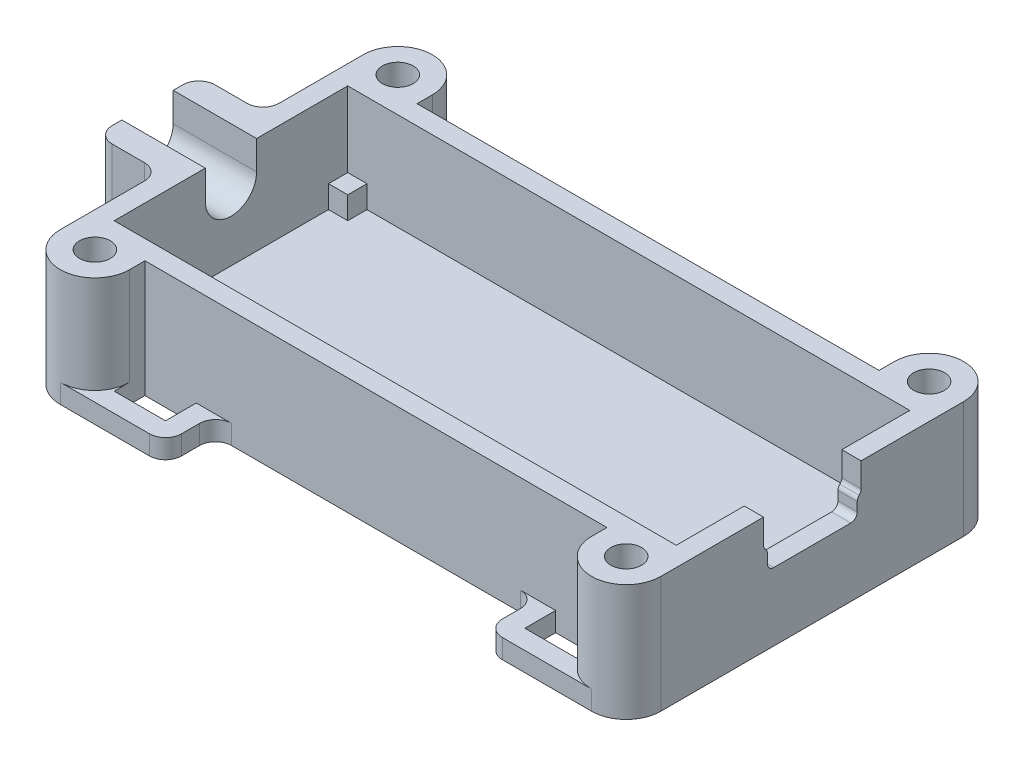
from build123d import *

# Parameters (mm, degrees)
SKETCH1_W           = 43.8
SKETCH1_H           = 18.2
SKETCH1_R           = 1.2
BOSS_EXTRUDE1_DEPTH = 7.6
BOSS_EXTRUDE2_START = 1.5
SKETCH3_R           = 1.2
BOSS_EXTRUDE2_DEPTH = 1.5
CUT_EXTRUDE1_REACH  = 56.325
SKETCH5_W           = 1.5
SKETCH5_H           = 1.5
BOSS_EXTRUDE3_DEPTH = 1.75
CUT_EXTRUDE2_REACH  = 56.325
BOSS_EXTRUDE4_DEPTH = 1.5
FILLET1_R           = 1.25
FILLET2_R           = 0.5


with BuildPart() as part:
    # Sketch1 → Boss-Extrude1 (new body)
    with BuildSketch(Plane(origin=(0, 0, 0), x_dir=(1, 0, 0), z_dir=(0, 1, 0))):
        with BuildLine():
            Line((-23.4, -4), (-23.4, -11.8))
            ThreePointArc((-23.4, -11.8), (-20.7, -14.5), (-18, -11.8))
            Line((-18, -11.8), (-18, -10.6))
            Line((-18, -10.6), (18, -10.6))
            Line((18, -10.6), (18, -11.8))
            ThreePointArc((18, -11.8), (20.7, -14.5), (23.4, -11.8))
            Line((23.4, -11.8), (23.4, 11.8))
            ThreePointArc((23.4, 11.8), (20.7, 14.5), (18, 11.8))
            Line((18, 11.8), (18, 10.6))
            Line((18, 10.6), (-18, 10.6))
            Line((-18, 10.6), (-18, 11.8))
            ThreePointArc((-18, 11.8), (-20.7, 14.5), (-23.4, 11.8))
            Line((-23.4, 11.8), (-23.4, 4))
            Line((-23.4, 4), (-28.4, 4))
            Line((-28.4, 4), (-28.4, -4))
            Line((-28.4, -4), (-23.4, -4))
        make_face()
        Rectangle(SKETCH1_W, SKETCH1_H, mode=Mode.SUBTRACT)
        with Locations((-20.7, -11.8)):
            Circle(SKETCH1_R, mode=Mode.SUBTRACT)
        with Locations((-20.7, 11.8)):
            Circle(SKETCH1_R, mode=Mode.SUBTRACT)
        with Locations((20.7, -11.8)):
            Circle(SKETCH1_R, mode=Mode.SUBTRACT)
        with Locations((20.7, 11.8)):
            Circle(SKETCH1_R, mode=Mode.SUBTRACT)
    extrude(amount=BOSS_EXTRUDE1_DEPTH)

    # Sketch3 → Boss-Extrude2 (add)
    with BuildSketch(Plane.XZ.offset(BOSS_EXTRUDE2_START)):
        with BuildLine():
            Line((-23.4, -4), (-23.4, -11.8))
            ThreePointArc((-23.4, -11.8), (-20.7, -14.5), (-18, -11.8))
            Line((-18, -11.8), (-18, -10.6))
            Line((-18, -10.6), (18, -10.6))
            Line((18, -10.6), (18, -11.8))
            ThreePointArc((18, -11.8), (20.7, -14.5), (23.4, -11.8))
            Line((23.4, -11.8), (23.4, 11.8))
            ThreePointArc((23.4, 11.8), (20.7, 14.5), (18, 11.8))
            Line((18, 11.8), (18, 10.6))
            Line((18, 10.6), (-18, 10.6))
            Line((-18, 10.6), (-18, 11.8))
            ThreePointArc((-18, 11.8), (-20.7, 14.5), (-23.4, 11.8))
            Line((-23.4, 11.8), (-23.4, 4))
            Line((-23.4, 4), (-28.4, 4))
            Line((-28.4, 4), (-28.4, -4))
            Line((-28.4, -4), (-23.4, -4))
        make_face()
        with Locations((-20.7, -11.8)):
            Circle(SKETCH3_R, mode=Mode.SUBTRACT)
        with Locations((20.7, -11.8)):
            Circle(SKETCH3_R, mode=Mode.SUBTRACT)
        with Locations((20.7, 11.8)):
            Circle(SKETCH3_R, mode=Mode.SUBTRACT)
        with Locations((-20.7, 11.8)):
            Circle(SKETCH3_R, mode=Mode.SUBTRACT)
    extrude(amount=-BOSS_EXTRUDE2_DEPTH)

    # Sketch4 → Cut-Extrude1 (cut, up to next)
    with BuildSketch(Plane.ZY.offset(28.4), mode=Mode.PRIVATE) as cut_extrude1_sk1:
        with BuildLine():
            Line((-2, 7.6), (-2, 5.35))
            ThreePointArc((-2, 5.35), (0, 3.35), (2, 5.35))
            Line((2, 5.35), (2, 7.6))
            Line((2, 7.6), (-2, 7.6))
        make_face()
    cut_extrude1_tool1 = extrude(cut_extrude1_sk1.sketch, amount=-CUT_EXTRUDE1_REACH, mode=Mode.PRIVATE) & part.part
    add(cut_extrude1_tool1.solids().sort_by_distance((-28.4, 5.663525, 0))[0], mode=Mode.SUBTRACT)

    # Sketch5 → Boss-Extrude3 (add)
    with BuildSketch(Plane(origin=(0, 0, 0), x_dir=(1, 0, 0), z_dir=(0, 1, 0))):
        with Locations((-21.15, 8.35)):
            Rectangle(SKETCH5_W, SKETCH5_H)
        with Locations((21.15, 8.35)):
            Rectangle(SKETCH5_W, SKETCH5_H)
        with Locations((-21.15, -8.35)):
            Rectangle(SKETCH5_W, SKETCH5_H)
        with Locations((21.15, -8.35)):
            Rectangle(SKETCH5_W, SKETCH5_H)
    extrude(amount=BOSS_EXTRUDE3_DEPTH)

    # Sketch6 → Cut-Extrude2 (cut, up to next)
    with BuildSketch(Plane(origin=(23.4, 0, 0), x_dir=(0, 0, -1), z_dir=(1, 0, 0)), mode=Mode.PRIVATE) as cut_extrude2_sk1:
        Polygon((3.8, 7.6), (-3.8, 7.6), (-3.8, 5.5), (-3.5, 5.2), (-3.5, 3.8), (3.5, 3.8), (3.5, 5.2), (3.8, 5.5), align=None)
    cut_extrude2_tool1 = extrude(cut_extrude2_sk1.sketch, amount=-CUT_EXTRUDE2_REACH, mode=Mode.PRIVATE) & part.part
    add(cut_extrude2_tool1.solids().sort_by_distance((23.4, 5.737352, 0))[0], mode=Mode.SUBTRACT)

    # Sketch8 → Boss-Extrude4 (add)
    with BuildSketch(Plane.XZ.offset(1.5)):
        with BuildLine():
            Line((12.5, 14.5), (12.5, 10.6))
            Line((12.5, 10.6), (14, 10.6))
            Line((14, 10.6), (14, 13))
            Line((14, 13), (18, 13))
            Line((18, 13), (18, 11.8))
            ThreePointArc((18, 11.8), (18.790811691, 13.709188309), (20.7, 14.5))
            Line((20.7, 14.5), (12.5, 14.5))
        make_face()
        with BuildLine():
            Line((-12.5, 14.5), (-20.7, 14.5))
            ThreePointArc((-20.7, 14.5), (-18.790811691, 13.709188309), (-18, 11.8))
            Line((-18, 11.8), (-18, 13))
            Line((-18, 13), (-14, 13))
            Line((-14, 13), (-14, 10.6))
            Line((-14, 10.6), (-12.5, 10.6))
            Line((-12.5, 10.6), (-12.5, 14.5))
        make_face()
        with BuildLine():
            Line((-20.7, -14.5), (-12.5, -14.5))
            Line((-12.5, -14.5), (-12.5, -10.6))
            Line((-12.5, -10.6), (-14, -10.6))
            Line((-14, -10.6), (-14, -13))
            Line((-14, -13), (-18, -13))
            Line((-18, -13), (-18, -11.8))
            ThreePointArc((-18, -11.8), (-18.790811691, -13.709188309), (-20.7, -14.5))
        make_face()
        with BuildLine():
            Line((14, -10.6), (12.5, -10.6))
            Line((12.5, -10.6), (12.5, -14.5))
            Line((12.5, -14.5), (20.7, -14.5))
            ThreePointArc((20.7, -14.5), (18.790811691, -13.709188309), (18, -11.8))
            Line((18, -11.8), (18, -13))
            Line((18, -13), (14, -13))
            Line((14, -13), (14, -10.6))
        make_face()
    extrude(amount=-BOSS_EXTRUDE4_DEPTH)

    # Fillet1
    fillet1_edges = [part.edges().sort_by_distance(p)[0] for p in [
        (-28.4, 3.05, 4),
        (-28.4, 3.05, -4),
        (-23.4, 3.05, -4),
        (-23.4, 3.05, 4),
        (-12.5, -0.75, -10.6),
        (-12.5, -0.75, -14.5),
        (12.5, -0.75, -14.5),
        (12.5, -0.75, -10.6),
        (12.5, -0.75, 14.5),
        (12.5, -0.75, 10.6),
        (-12.5, -0.75, 10.6),
        (-12.5, -0.75, 14.5),
    ]]
    fillet(fillet1_edges, radius=FILLET1_R)

    # Fillet2
    fillet2_edges = [part.edges().sort_by_distance(p)[0] for p in [
        (22.65, 3.8, 3.5),
        (22.65, 3.8, -3.5),
        (22.65, 5.2, -3.5),
        (22.65, 5.5, -3.8),
        (22.65, 5.2, 3.5),
        (22.65, 5.5, 3.8),
    ]]
    fillet(fillet2_edges, radius=FILLET2_R)


solid = part.part
